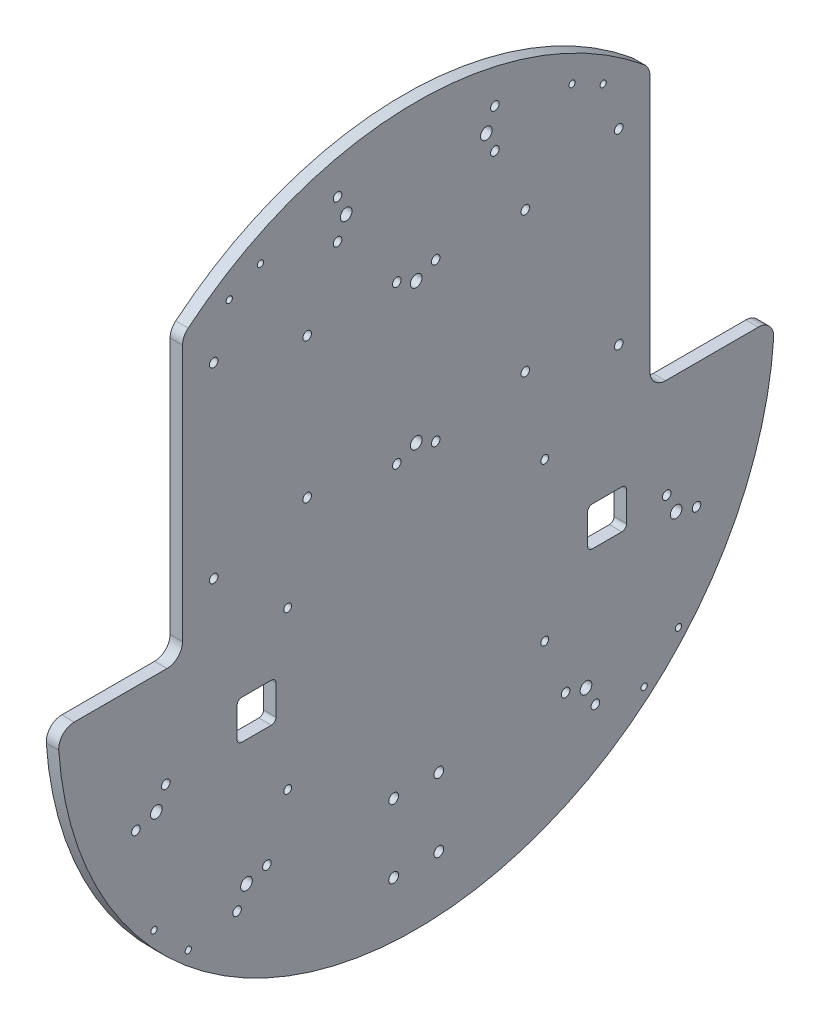
from build123d import *

# Parameters (mm, degrees)
SKETCH_1_R           = 230
EXTRUDE_1_DEPTH      = 8
SKETCH_2_W           = 80
SKETCH_2_H           = 200
CUT_EXTRUDE_1_DEPTH  = 12
SKETCH_3_R           = 2.75
CUT_EXTRUDE_2_DEPTH  = 12
SKETCH_4_R           = 3.15
CUT_EXTRUDE_3_DEPTH  = 12
SKETCH_5_R           = 3.75
SKETCH_5_R_2         = 2.75
CUT_EXTRUDE_4_DEPTH  = 10
FILLET_1_R           = 10
SKETCH_6_W           = 25
SKETCH_6_H           = 25
CUT_EXTRUDE_5_DEPTH  = 10
SKETCH_7_R           = 2.5
CUT_EXTRUDE_6_DEPTH  = 10
SKETCH_8_W           = 25
SKETCH_8_H           = 25
CUT_EXTRUDE_7_DEPTH  = 10
FILLET_3_R           = 3
SKETCH_10_R          = 2
CUT_EXTRUDE_9_DEPTH  = 326.005785815
SKETCH_11_R          = 2
CUT_EXTRUDE_10_DEPTH = 25
FILLET_4_R           = 3


with BuildPart() as part:
    # 草图1 → 凸台-拉伸1 (new body)
    with BuildSketch(Plane(origin=(0, 0, 0), x_dir=(0, 0, -1), z_dir=(1, 0, 0))):
        Circle(SKETCH_1_R)
    extrude(amount=EXTRUDE_1_DEPTH)

    # 草图2 → 切除-拉伸1 (cut)
    with BuildSketch(Plane(origin=(8, 0, 0), x_dir=(0, 0, -1), z_dir=(1, 0, 0))):
        with Locations((-190, 95)):
            Rectangle(SKETCH_2_W, SKETCH_2_H)
        with Locations((190, 95)):
            Rectangle(SKETCH_2_W, SKETCH_2_H)
    extrude(amount=-CUT_EXTRUDE_1_DEPTH, mode=Mode.SUBTRACT)

    # 草图3 → 切除-拉伸2 (cut)
    with BuildSketch(Plane(origin=(8, 0, 0), x_dir=(0, 0, -1), z_dir=(1, 0, 0))):
        with Locations((-130, 150)):
            Circle(SKETCH_3_R)
        with Locations((-130, 30)):
            Circle(SKETCH_3_R)
        with Locations((130, 30)):
            Circle(SKETCH_3_R)
        with Locations((130, 150)):
            Circle(SKETCH_3_R)
        with Locations((-70, 135)):
            Circle(SKETCH_3_R)
        with Locations((-70, 45)):
            Circle(SKETCH_3_R)
        with Locations((70, 135)):
            Circle(SKETCH_3_R)
        with Locations((70, 45)):
            Circle(SKETCH_3_R)
    extrude(amount=-CUT_EXTRUDE_2_DEPTH, mode=Mode.SUBTRACT)

    # 草图4 → 切除-拉伸3 (cut)
    with BuildSketch(Plane(origin=(8, 0, 0), x_dir=(0, 0, -1), z_dir=(1, 0, 0))):
        with Locations((-14.5, -150)):
            Circle(SKETCH_4_R)
        with Locations((14.5, -150)):
            Circle(SKETCH_4_R)
        with Locations((14.5, -194)):
            Circle(SKETCH_4_R)
        with Locations((-14.5, -194)):
            Circle(SKETCH_4_R)
    extrude(amount=-CUT_EXTRUDE_3_DEPTH, mode=Mode.SUBTRACT)

    # 草图5 → 切除-拉伸4 (cut)
    with BuildSketch(Plane(origin=(8, 0, 0), x_dir=(0, 0, -1), z_dir=(1, 0, 0))):
        with Locations((166.813442197, -81.229769803)):
            Circle(SKETCH_5_R)
        with Locations((108.962557326, -150.173769684)):
            Circle(SKETCH_5_R)
        with Locations((-108.962557326, -150.173769684)):
            Circle(SKETCH_5_R)
        with Locations((-166.813442197, -81.229769803)):
            Circle(SKETCH_5_R)
        with Locations((-45, 190)):
            Circle(SKETCH_5_R)
        with Locations((45, 190)):
            Circle(SKETCH_5_R)
        with Locations((-12.5, 35)):
            Circle(SKETCH_5_R_2)
        with Locations((12.5, 35)):
            Circle(SKETCH_5_R_2)
        with Locations((95.851669933, -146.352169)):
            Circle(SKETCH_5_R_2)
        with Locations((160.773218512, -68.981680245)):
            Circle(SKETCH_5_R_2)
        with Locations((179.92432959, -85.051370487)):
            Circle(SKETCH_5_R_2)
        with Locations((115.002781011, -162.421859242)):
            Circle(SKETCH_5_R_2)
        with Locations((-179.92432959, -85.051370487)):
            Circle(SKETCH_5_R_2)
        with Locations((-160.773218512, -68.981680245)):
            Circle(SKETCH_5_R_2)
        with Locations((-95.851669933, -146.352169)):
            Circle(SKETCH_5_R_2)
        with Locations((-115.002781011, -162.421859242)):
            Circle(SKETCH_5_R_2)
        with Locations((50.5, 202.5)):
            Circle(SKETCH_5_R_2)
        with Locations((-50.5, 202.5)):
            Circle(SKETCH_5_R_2)
        with Locations((50.5, 177.5)):
            Circle(SKETCH_5_R_2)
        with Locations((-50.5, 177.5)):
            Circle(SKETCH_5_R_2)
        with Locations((12.5, 136)):
            Circle(SKETCH_5_R_2)
        with Locations((-12.5, 136)):
            Circle(SKETCH_5_R_2)
        with Locations((0, 130.5)):
            Circle(SKETCH_5_R)
        with Locations((0, 40.5)):
            Circle(SKETCH_5_R)
    extrude(amount=-CUT_EXTRUDE_4_DEPTH, mode=Mode.SUBTRACT)

    # 圆角1
    fillet_1_edges = [part.edges().sort_by_distance(p)[0] for p in [
        (4, 174.355957742, 150),
        (4, -5, 150),
        (4, -5, 229.945645751),
        (4, 174.355957742, -150),
        (4, -5, -229.945645751),
        (4, -5, -150),
    ]]
    fillet(fillet_1_edges, radius=FILLET_1_R)

    # 草图6 → 切除-拉伸5 (cut)
    with BuildSketch(Plane(origin=(8, 0, 0), x_dir=(0, 0, -1), z_dir=(1, 0, 0))):
        with Locations((-102.5, -57.5)):
            Rectangle(SKETCH_6_W, SKETCH_6_H)
    extrude(amount=-CUT_EXTRUDE_5_DEPTH, mode=Mode.SUBTRACT)

    # 草图7 → 切除-拉伸6 (cut)
    with BuildSketch(Plane(origin=(8, 0, 0), x_dir=(0, 0, -1), z_dir=(1, 0, 0))):
        with Locations((82.5, -10)):
            Circle(SKETCH_7_R)
        with Locations((82.5, -111)):
            Circle(SKETCH_7_R)
        with Locations((-82.5, -10)):
            Circle(SKETCH_7_R)
        with Locations((-82.5, -111)):
            Circle(SKETCH_7_R)
    extrude(amount=-CUT_EXTRUDE_6_DEPTH, mode=Mode.SUBTRACT)

    # 草图8 → 切除-拉伸7 (cut)
    with BuildSketch(Plane(origin=(8, 0, 0), x_dir=(0, 0, -1), z_dir=(1, 0, 0))):
        with Locations((122.5, -62.5)):
            Rectangle(SKETCH_8_W, SKETCH_8_H)
    extrude(amount=-CUT_EXTRUDE_7_DEPTH, mode=Mode.SUBTRACT)

    # 圆角3
    fillet_3_edges = [part.edges().sort_by_distance(p)[0] for p in [
        (4, -75, -135),
        (4, -75, -110),
        (4, -50, -110),
        (4, -50, -135),
    ]]
    fillet(fillet_3_edges, radius=FILLET_3_R)

    # 草图10 → 切除-拉伸9 (cut, through all)
    with BuildSketch(Plane(origin=(8, 0, 0), x_dir=(0, 0, -1), z_dir=(1, 0, 0))):
        with Locations((168.30023639, -146.301163465)):
            Circle(SKETCH_10_R)
        with Locations((146.301163465, -168.30023639)):
            Circle(SKETCH_10_R)
        with Locations((-146.301163465, -168.30023639)):
            Circle(SKETCH_10_R)
        with Locations((-168.30023639, -146.301163465)):
            Circle(SKETCH_10_R)
    extrude(amount=-CUT_EXTRUDE_9_DEPTH, mode=Mode.SUBTRACT)

    # 草图11 → 切除-拉伸10 (cut)
    with BuildSketch(Plane(origin=(8, 0, 0), x_dir=(0, 0, -1), z_dir=(1, 0, 0))):
        with Locations((100, 190)):
            Circle(SKETCH_11_R)
        with Locations((120, 180)):
            Circle(SKETCH_11_R)
        with Locations((-120, 180)):
            Circle(SKETCH_11_R)
        with Locations((-100, 190)):
            Circle(SKETCH_11_R)
    extrude(amount=-CUT_EXTRUDE_10_DEPTH, mode=Mode.SUBTRACT)

    # 圆角4
    fillet_4_edges = [part.edges().sort_by_distance(p)[0] for p in [
        (4, -70, 90),
        (4, -70, 115),
        (4, -45, 115),
        (4, -45, 90),
    ]]
    fillet(fillet_4_edges, radius=FILLET_4_R)


solid = part.part
